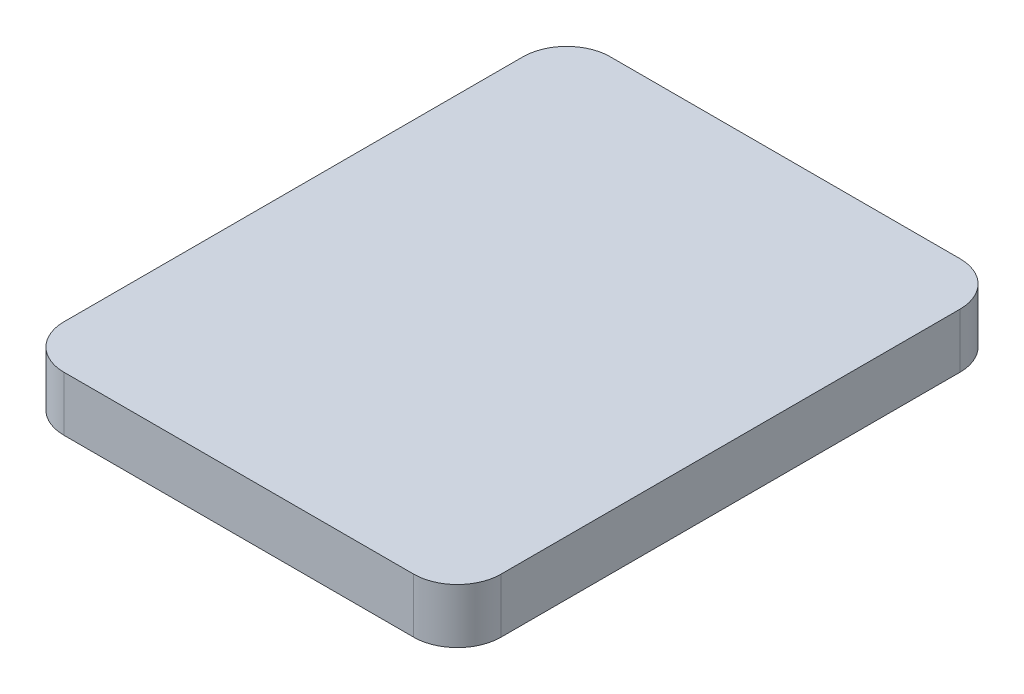
from build123d import *

# Parameters (mm, degrees)
SKETCH1_W           = 25.4
SKETCH1_H           = 31.75
BOSS_EXTRUDE1_DEPTH = 3.175
FILLET1_R           = 2.54


with BuildPart() as part:
    # Sketch1 → Boss-Extrude1 (new body)
    with BuildSketch(Plane(origin=(0, 0, 0), x_dir=(1, 0, 0), z_dir=(0, 1, 0))):
        with Locations((12.7, 15.875)):
            Rectangle(SKETCH1_W, SKETCH1_H)
    extrude(amount=BOSS_EXTRUDE1_DEPTH)

    # Fillet1
    fillet1_edges = [part.edges().sort_by_distance(p)[0] for p in [
        (0, 1.5875, -31.75),
        (25.4, 1.5875, -31.75),
        (25.4, 1.5875, 0),
        (0, 1.5875, 0),
    ]]
    fillet(fillet1_edges, radius=FILLET1_R)


solid = part.part
